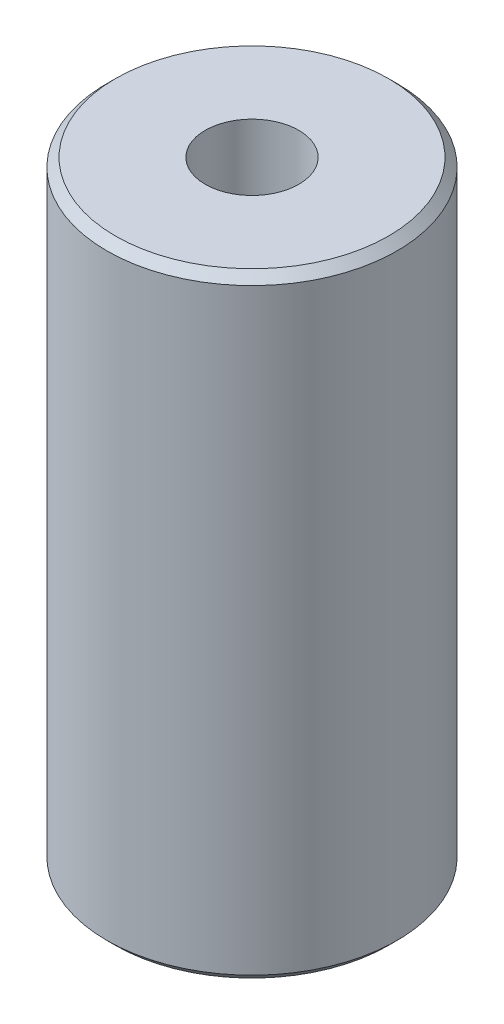
from build123d import *

# Parameters (mm, degrees)
SKETCH1_R           = 22.5
BOSS_EXTRUDE1_DEPTH = 95.300944877
SKETCH2_R           = 7.259422893
CUT_EXTRUDE1_DEPTH  = 101.47273309
CHAMFER1_SIZE       = 1.329378043


with BuildPart() as part:
    # Sketch1 → Boss-Extrude1 (new body)
    with BuildSketch(Plane(origin=(0, 0, 0), x_dir=(1, 0, 0), z_dir=(0, 1, 0))):
        Circle(SKETCH1_R)
    extrude(amount=BOSS_EXTRUDE1_DEPTH)

    # Sketch2 → Cut-Extrude1 (cut, through all)
    with BuildSketch(Plane(origin=(0, 0, 0), x_dir=(1, 0, 0), z_dir=(0, 1, 0))):
        Circle(SKETCH2_R)
    extrude(amount=CUT_EXTRUDE1_DEPTH, mode=Mode.SUBTRACT)

    # Chamfer1
    chamfer1_edges = [part.edges().sort_by_distance(p)[0] for p in [
        (-22.5, 95.300944877, 0),
        (-22.5, 0, 0),
    ]]
    chamfer(chamfer1_edges, length=CHAMFER1_SIZE)


solid = part.part
